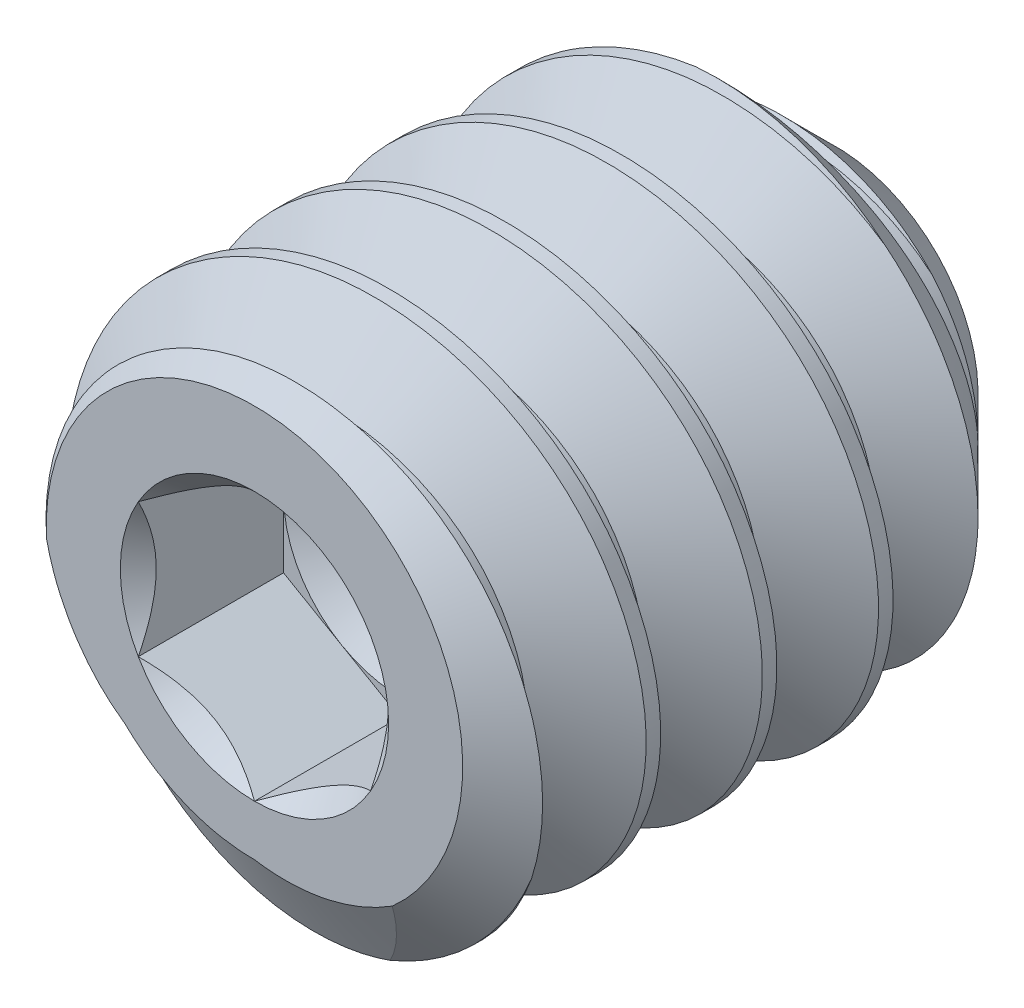
from build123d import *

# Parameters (mm, degrees)
CUT_SWEEP2_PITCH    = 0.635
CUT_EXTRUDE10_DEPTH = 0.79375


with BuildPart() as part:
    # Sketch22 → Revolve1 (revolve)
    with BuildSketch(Plane(origin=(0, 0, 0), x_dir=(0, 0, -1), z_dir=(1, 0, 0)), mode=Mode.PRIVATE) as revolve1_sk:
        Polygon((-1.353337021, 0), (-1.353337021, 1.13792), (-1.154141981, 1.4224), (1.178688262, 1.4224), (1.821662979, 0.779425283), (1.821662979, 0), (1.353337021, 0), align=None)
    revolve(revolve1_sk.sketch.rotate(Axis((0, 0, -1.353337021), (0, 0, -1)), 180), axis=Axis((0, 0, -1.353337021), (0, 0, -1)))

    # Cut-Sweep2: the profile of Sketch28 profile screwed along a right-hand helix of 6 turns, 6 arcs to a turn; built about Z, then put on its axis
    cut_sweep2_z = Axis((0, 0, 0), (0, 0, 1))
    cut_sweep2_corners = [(1.4227, 0, 0.000173205), (1.4227, 0, -0.555798205), (1.009955401, 0, -0.3175), (1.009955401, 0, -0.238125)]
    with BuildLine(mode=Mode.PRIVATE) as cut_sweep2_profile:
        Line(cut_sweep2_corners[0], cut_sweep2_corners[1])
        Line(cut_sweep2_corners[1], cut_sweep2_corners[2])
        Line(cut_sweep2_corners[2], cut_sweep2_corners[3])
        Line(cut_sweep2_corners[3], cut_sweep2_corners[0])
    cut_sweep2_cap = Face(cut_sweep2_profile.wire())
    cut_sweep2_turn_angles = [0, 30, 60, 90, 120, 150, 180, 210, 240, 270, 300, 330, 360]
    cut_sweep2_turn_weights = [1, 0.8660254037844387, 1, 0.8660254037844387, 1, 0.8660254037844387, 1, 0.8660254037844387, 1, 0.8660254037844387, 1, 0.8660254037844387, 1]
    cut_sweep2_turn_rails = [Edge.make_bspline([Vector(p[0], p[1], 0).rotate(cut_sweep2_z, cut_sweep2_turn_angles[k]) / cut_sweep2_turn_weights[k] + Vector(0, 0, p[2] + CUT_SWEEP2_PITCH * cut_sweep2_turn_angles[k] / 360) for k in range(13)], [0, 0, 0, 1, 1, 2, 2, 3, 3, 4, 4, 5, 5, 6, 6, 6], 2, cut_sweep2_turn_weights) for p in cut_sweep2_corners]
    cut_sweep2_turn_sides = [Face.make_surface_from_curves(cut_sweep2_turn_rails[p[0]], cut_sweep2_turn_rails[p[1]]) for p in [(0, 1), (1, 2), (2, 3), (3, 0)]]
    cut_sweep2 = Plane(origin=(0, 0, -1.821662979), x_dir=(0, 1, 0), z_dir=(0, 0, 1)) * Solid(Shell([*[p.moved(Location((0, 0, CUT_SWEEP2_PITCH * i))) for i in range(6) for p in cut_sweep2_turn_sides], cut_sweep2_cap, cut_sweep2_cap.rotate(cut_sweep2_z, 2160).moved(Location((0, 0, CUT_SWEEP2_PITCH * 2160 / 360)))]))
    add(cut_sweep2, mode=Mode.SUBTRACT)

    # Sketch23 → Cut-Extrude10 (cut)
    with BuildSketch(Plane.XY.offset(1.353337021)):
        Polygon((0, 0.733234842), (-0.635, 0.366617421), (-0.635, -0.366617421), (0, -0.733234842), (0.635, -0.366617421), (0.635, 0.366617421), align=None)
    extrude(amount=-CUT_EXTRUDE10_DEPTH, mode=Mode.SUBTRACT)

    # Cut-Extrude11 cone 1 section (through the dimple's axis) → Cut-Extrude11 (revolve, cut)
    with BuildSketch(Plane(origin=(0, 0, 1.353337021), x_dir=(0, -1, 0), z_dir=(1, 0, 0))):
        Polygon((0, 0), (0.733234842, 0), (0, 0.733234842), align=None)
    revolve(axis=Axis((0, 0, 1.353337021), (0, 0, -1)), mode=Mode.SUBTRACT)

    # Cut-Extrude12 cone 1 section (through the dimple's axis) → Cut-Extrude12 (revolve, cut)
    with BuildSketch(Plane(origin=(0, 0, 0.559587021), x_dir=(0, -1, 0), z_dir=(1, 0, 0))):
        Polygon((0, 0), (0.635, 0), (0, 0.366617421), align=None)
    revolve(axis=Axis((0, 0, 0.559587021), (0, 0, -1)), mode=Mode.SUBTRACT)


solid = part.part
